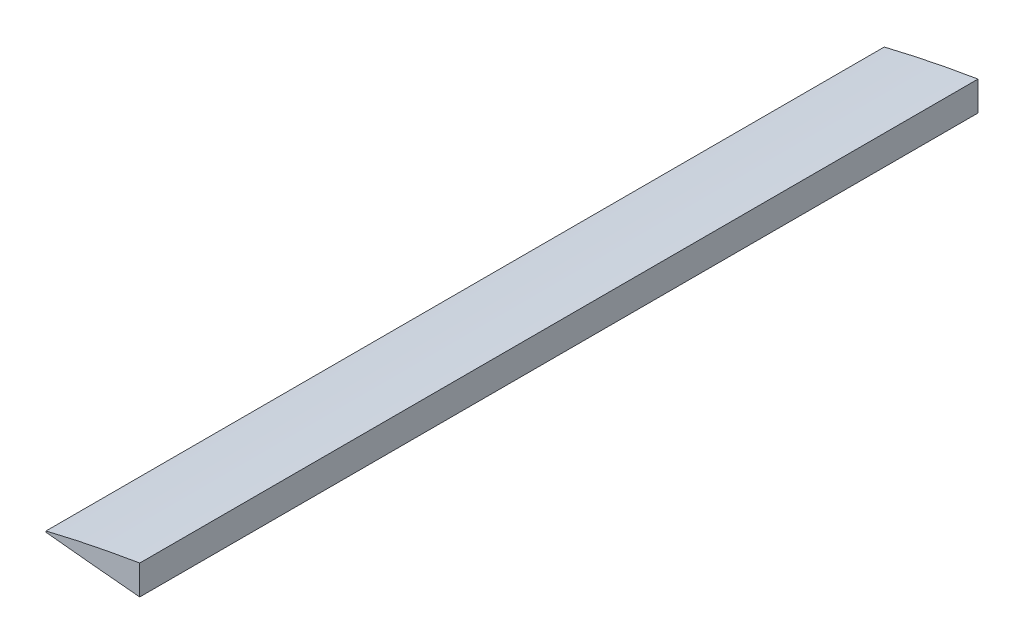
from build123d import *

# Parameters (mm, degrees)
BOSS_EXTRUDE1_DEPTH = 612
SKETCH2_W           = 21
SKETCH2_H           = 11.5
CUT_EXTRUDE1_DEPTH  = 13


with BuildPart() as part:
    # Sketch1 → Boss-Extrude1 (new body)
    with BuildSketch(Plane.XY):
        with BuildLine():
            Line((-194.78206, 14.362329856), (-194.78206, -7.118101813))
            add(Edge.make_bspline(
                [(-194.78206, -7.118101813), (-196.512686719, -6.961210383), (-201.112755742, -6.544187234), (-208.425137277, -5.864747708), (-216.54669625, -5.099699317), (-224.149671302, -4.371224172), (-231.185732748, -3.686594781), (-237.609816157, -3.051792113), (-243.380580393, -2.473170444), (-248.460634018, -1.95604425), (-252.81702039, -1.50811956), (-256.420946665, -1.129170423), (-259.24954449, -0.839207545), (-261.282177522, -0.605141161), (-262.509467907, -0.506345529), (-263.063019725, -0.413096521), (-263.209805993, -0.413618993), (-263.219, -0.413651718)],
                knots=[0, 0, 0, 0, 0.075810952, 0.201508279, 0.320388141, 0.43169539, 0.534719075, 0.628797147, 0.713321079, 0.787740393, 0.851567051, 0.904379655, 0.945827345, 0.975633259, 0.993597432, 0.999598973, 1, 1, 1, 1], degree=3))
            Line((-263.219, -0.413651718), (-263.219, 0.420386619))
            add(Edge.make_bspline(
                [(-194.78206, 14.362329856), (-196.780843948, 14.03082617), (-201.644283213, 13.224211706), (-209.199024776, 11.87840653), (-217.274846429, 10.378455268), (-224.816873175, 8.910515534), (-231.78070947, 7.49966041), (-238.124942714, 6.166292522), (-243.812252153, 4.931299241), (-248.809365304, 3.814412811), (-253.087249349, 2.834113315), (-256.62120211, 2.007090349), (-259.39094467, 1.34784408), (-261.380642681, 0.868109535), (-262.569816785, 0.578993853), (-263.094507616, 0.450802366), (-263.219, 0.420386619)],
                knots=[0, 0, 0, 0, 0.087007005, 0.211705365, 0.329527113, 0.439740645, 0.541660709, 0.634652346, 0.718134669, 0.791584505, 0.854539888, 0.906603358, 0.947445002, 0.976805146, 0.994496602, 1, 1, 1, 1], degree=3))
        make_face()
    extrude(amount=BOSS_EXTRUDE1_DEPTH)

    # Sketch2 → Cut-Extrude1 (cut)
    with BuildSketch(Plane.XY.offset(83.9)):
        with Locations((-207.415, -1.948)):
            Rectangle(SKETCH2_W, SKETCH2_H)
    extrude(amount=CUT_EXTRUDE1_DEPTH, mode=Mode.SUBTRACT)


solid = part.part
